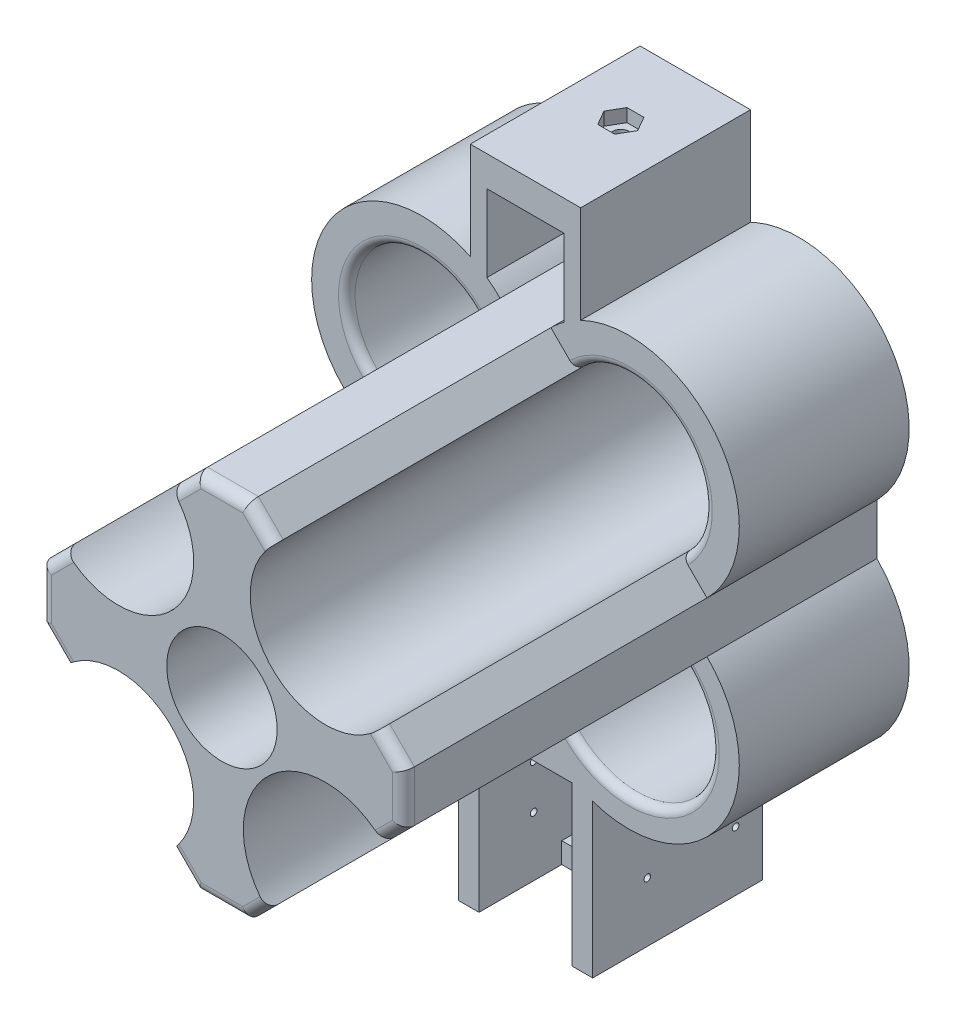
from build123d import *
from build123d.topology import SkipClean

# Parameters (mm, degrees)
SKETCH_1_R           = 27
SKETCH_1_R_2         = 29.5
EXTRUDE_1_DEPTH      = 50
EXTRUDE_START        = 110
EXTRUDE_2_DEPTH      = 110
SKETCH_3_R           = 20
CUT_EXTRUDE_1_DEPTH  = 70
SKETCH_22_R          = 20
EXTRUDE_6_DEPTH      = 171.56
FILLET_1_R           = 4
EXTRUDE_START_2      = 50
EXTRUDE_8_DEPTH      = 50
SKETCH_28_R          = 27.25
SKETCH_28_R_2        = 29.75
CUT_EXTRUDE_8_DEPTH  = 160
EXTRUDE_15_DEPTH     = 61.56
SKETCH_37_R          = 2.95
CUT_EXTRUDE_9_DEPTH  = 15
CUT_EXTRUDE_10_DEPTH = 4.75
SKETCH_41_W          = 48.7
SKETCH_41_H          = 65
SKETCH_41_W_2        = 33.7
SKETCH_41_H_2        = 50
EXTRUDE_16_DEPTH     = 61.56
SKETCH_42_W          = 33.7
SKETCH_42_H          = 50
EXTRUDE_17_DEPTH     = 3
SKETCH_43_W          = 33.7
SKETCH_43_H          = 30
CUT_EXTRUDE_11_DEPTH = 7.5
SKETCH_44_R          = 1.2
CUT_EXTRUDE_12_DEPTH = 199.942072292
FILLET_2_R           = 3


with BuildPart() as part:
    # 스케치1 → 보스-돌출1 (new body)
    with BuildSketch(Plane.XY):
        with BuildLine():
            ThreePointArc((0, 51.419410907), (65.784271247, 65.784271247), (51.419410907, 0))
            ThreePointArc((51.419410907, 0), (65.784271247, -65.784271247), (0, -51.419410907))
            ThreePointArc((0, -51.419410907), (-65.784271247, -65.784271247), (-51.419410907, 0))
            ThreePointArc((-51.419410907, 0), (-65.784271247, 65.784271247), (0, 51.419410907))
        make_face()
        with Locations((-37.5, 37.5)):
            Circle(SKETCH_1_R, mode=Mode.SUBTRACT)
        with Locations((37.5, 37.5)):
            Circle(SKETCH_1_R, mode=Mode.SUBTRACT)
        with Locations((-37.5, -37.5)):
            Circle(SKETCH_1_R, mode=Mode.SUBTRACT)
        with Locations((37.5, -37.5)):
            Circle(SKETCH_1_R_2, mode=Mode.SUBTRACT)
    extrude(amount=-EXTRUDE_1_DEPTH)

    # 스케치2 → 보스-돌출2 (add)
    with BuildSketch(Plane.XY.offset(EXTRUDE_START)):
        with BuildLine():
            ThreePointArc((9.215728753, -65.784271247), (3.832806933, -59.099076623), (0, -51.419410907))
            ThreePointArc((0, -51.419410907), (-3.832806933, -59.099076623), (-9.215728753, -65.784271247))
            Line((-9.215728753, -65.784271247), (-18.408116908, -56.591883092))
            ThreePointArc((-18.408116908, -56.591883092), (-18.408116908, -18.408116908), (-56.591883092, -18.408116908))
            Line((-56.591883092, -18.408116908), (-65.784271247, -9.215728753))
            ThreePointArc((-65.784271247, -9.215728753), (-59.099076623, -3.832806933), (-51.419410907, 0))
            ThreePointArc((-51.419410907, 0), (-59.099076623, 3.832806933), (-65.784271247, 9.215728753))
            Line((-65.784271247, 9.215728753), (-56.591883092, 18.408116908))
            ThreePointArc((-56.591883092, 18.408116908), (-18.408116908, 18.408116908), (-18.408116908, 56.591883092))
            Line((-18.408116908, 56.591883092), (-9.215728753, 65.784271247))
            ThreePointArc((-9.215728753, 65.784271247), (-3.832806933, 59.099076623), (0, 51.419410907))
            ThreePointArc((0, 51.419410907), (3.832806933, 59.099076623), (9.215728753, 65.784271247))
            Line((9.215728753, 65.784271247), (18.408116908, 56.591883092))
            ThreePointArc((18.408116908, 56.591883092), (18.408116908, 18.408116908), (56.591883092, 18.408116908))
            Line((56.591883092, 18.408116908), (65.784271247, 9.215728753))
            ThreePointArc((65.784271247, 9.215728753), (59.099076623, 3.832806933), (51.419410907, 0))
            ThreePointArc((51.419410907, 0), (59.099076623, -3.832806933), (65.784271247, -9.215728753))
            Line((65.784271247, -9.215728753), (58.359650045, -16.640349955))
            ThreePointArc((58.359650045, -16.640349955), (16.640349955, -16.640349955), (16.640349955, -58.359650045))
            Line((16.640349955, -58.359650045), (9.215728753, -65.784271247))
        make_face()
    extrude(amount=-EXTRUDE_2_DEPTH)

    # 스케치3 → 컷-돌출1 (cut)
    with BuildSketch(Plane.XY.offset(110)):
        Circle(SKETCH_3_R)
    extrude(amount=-CUT_EXTRUDE_1_DEPTH, mode=Mode.SUBTRACT)

    # 스케치4 → 회전1 (revolve)
    with BuildSketch(Plane(origin=(0, 37.5, 0), x_dir=(1, 0, 0), z_dir=(0, 1, 0)), mode=Mode.PRIVATE) as revolve_1_sk:
        Polygon((-57, 61.564692494), (-77.5, 61.564692494), (-77.5, 50), (-64.5, 50), (-44, 61.564692494), align=None)
    revolve(revolve_1_sk.sketch.rotate(Axis((-37.5, 37.5, -65.231546212), (0, 0, -1)), 180), axis=Axis((-37.5, 37.5, -65.231546212), (0, 0, -1)))

    # 스케치5 → 회전2 (revolve)
    with SkipClean():  # the faces are left unmerged after this step: merging them gives an invalid solid
        with BuildSketch(Plane(origin=(0, 37.5, 0), x_dir=(1, 0, 0), z_dir=(0, 1, 0))):
            Polygon((44, 61.564692494), (57, 61.564692494), (77.5, 61.564692494), (77.5, 50), (64.5, 50), align=None)
        revolve(axis=Axis((37.5, 37.5, -50), (0, 0, 1)))

    # 스케치6 → 회전3 (revolve)
    with SkipClean():  # the faces are left unmerged after this step: merging them gives an invalid solid
        with BuildSketch(Plane(origin=(0, -37.5, 0), x_dir=(1, 0, 0), z_dir=(0, 1, 0)), mode=Mode.PRIVATE) as revolve_3_sk:
            Polygon((-57, 61.564692494), (-77.5, 61.564692494), (-77.5, 50), (-64.5, 50), (-44, 61.564692494), align=None)
        revolve(revolve_3_sk.sketch.rotate(Axis((-37.5, -37.5, -65.231546212), (0, 0, -1)), 180), axis=Axis((-37.5, -37.5, -65.231546212), (0, 0, -1)))

    # 스케치7 → 회전4 (revolve)
    with SkipClean():  # the faces are left unmerged after this step: merging them gives an invalid solid
        with BuildSketch(Plane(origin=(0, -37.5, 0), x_dir=(1, 0, 0), z_dir=(0, 1, 0))):
            Polygon((46.75, 60.152594543), (46.75, 61.564692494), (77.5, 61.564692494), (77.5, 50), (67, 50), align=None)
        revolve(axis=Axis((37.5, -37.5, -64.790199458), (0, 0, -1)))

    # 스케치22 → 보스-돌출6 (add)
    with BuildSketch(Plane.XY.offset(110)):
        with BuildLine():
            ThreePointArc((58.889980131, -16.110019869), (16.110019869, -16.110019869), (16.110019869, -58.889980131))
            Line((16.110019869, -58.889980131), (9.215728753, -65.784271247))
            Line((9.215728753, -65.784271247), (-9.215728753, -65.784271247))
            Line((-9.215728753, -65.784271247), (-18.054563517, -56.945436483))
            ThreePointArc((-18.054563517, -56.945436483), (-18.054563517, -18.054563517), (-56.945436483, -18.054563517))
            Line((-56.945436483, -18.054563517), (-65.784271247, -9.215728753))
            Line((-65.784271247, -9.215728753), (-65.784271247, 9.215728753))
            Line((-65.784271247, 9.215728753), (-56.945436483, 18.054563517))
            ThreePointArc((-56.945436483, 18.054563517), (-18.054563517, 18.054563517), (-18.054563517, 56.945436483))
            Line((-18.054563517, 56.945436483), (-9.215728753, 65.784271247))
            Line((-9.215728753, 65.784271247), (9.215728753, 65.784271247))
            Line((9.215728753, 65.784271247), (18.054563517, 56.945436483))
            ThreePointArc((18.054563517, 56.945436483), (18.054563517, 18.054563517), (56.945436483, 18.054563517))
            Line((56.945436483, 18.054563517), (65.784271247, 9.215728753))
            Line((65.784271247, 9.215728753), (65.784271247, -9.215728753))
            Line((65.784271247, -9.215728753), (58.889980131, -16.110019869))
        make_face()
        Circle(SKETCH_22_R, mode=Mode.SUBTRACT)
    extrude(amount=-EXTRUDE_6_DEPTH)

    # 필렛1
    fillet_1_edges = [part.edges().sort_by_distance(p)[0] for p in [
        (0, -65.784271247, 110),
        (0, 65.784271247, 110),
        (65.784271247, 0, 110),
        (-65.784271247, 0, 110),
        (12.928039354, -62.071960646, 110),
        (61.18807717, 13.81192283, 110),
        (-13.81192283, 61.18807717, 110),
        (-61.18807717, -13.81192283, 110),
        (62.071960646, -12.928039354, 110),
        (13.81192283, 61.18807717, 110),
        (-61.18807717, 13.81192283, 110),
        (-13.81192283, -61.18807717, 110),
    ]]
    fillet(fillet_1_edges, radius=FILLET_1_R)

    # 스케치26 → 보스-돌출8 (add)
    with BuildSketch(Plane.XY.offset(-61.56).offset(EXTRUDE_START_2)):
        with BuildLine():
            ThreePointArc((9.215728753, -65.784271247), (3.832806933, -59.099076623), (0, -51.419410907))
            ThreePointArc((0, -51.419410907), (-3.832806933, -59.099076623), (-9.215728753, -65.784271247))
            Line((-9.215728753, -65.784271247), (-18.408116908, -56.591883092))
            ThreePointArc((-18.408116908, -56.591883092), (-18.408116908, -18.408116908), (-56.591883092, -18.408116908))
            Line((-56.591883092, -18.408116908), (-65.784271247, -9.215728753))
            ThreePointArc((-65.784271247, -9.215728753), (-59.099076623, -3.832806933), (-51.419410907, 0))
            ThreePointArc((-51.419410907, 0), (-59.099076623, 3.832806933), (-65.784271247, 9.215728753))
            Line((-65.784271247, 9.215728753), (-56.591883092, 18.408116908))
            ThreePointArc((-56.591883092, 18.408116908), (-18.408116908, 18.408116908), (-18.408116908, 56.591883092))
            Line((-18.408116908, 56.591883092), (-9.215728753, 65.784271247))
            ThreePointArc((-9.215728753, 65.784271247), (-3.832806933, 59.099076623), (0, 51.419410907))
            ThreePointArc((0, 51.419410907), (3.832806933, 59.099076623), (9.215728753, 65.784271247))
            Line((9.215728753, 65.784271247), (18.408116908, 56.591883092))
            ThreePointArc((18.408116908, 56.591883092), (18.408116908, 18.408116908), (56.591883092, 18.408116908))
            Line((56.591883092, 18.408116908), (65.784271247, 9.215728753))
            ThreePointArc((65.784271247, 9.215728753), (59.099076623, 3.832806933), (51.419410907, 0))
            ThreePointArc((51.419410907, 0), (59.099076623, -3.832806933), (65.784271247, -9.215728753))
            Line((65.784271247, -9.215728753), (58.359650045, -16.640349955))
            ThreePointArc((58.359650045, -16.640349955), (16.640349955, -16.640349955), (16.640349955, -58.359650045))
            Line((16.640349955, -58.359650045), (9.215728753, -65.784271247))
        make_face()
    extrude(amount=-EXTRUDE_8_DEPTH)

    # 스케치28 → 컷-돌출8 (cut)
    with BuildSketch(Plane.XY.offset(110)):
        with Locations((-37.5, 37.5)):
            Circle(SKETCH_28_R)
        with Locations(Location((37.5, 37.5, 0), (0, 0, 315))):
            Circle(SKETCH_28_R)
        with Locations(Location((-37.5, -37.5, 0), (0, 0, 323.440889441))):
            Circle(SKETCH_28_R)
        with Locations((37.5, -37.5)):
            Circle(SKETCH_28_R_2)
    extrude(amount=-CUT_EXTRUDE_8_DEPTH, mode=Mode.SUBTRACT)

    # 스케치36 → 보스-돌출15 (add)
    with BuildSketch(Plane.XY.offset(-61.56)):
        Polygon((20, 108.784271247), (20, 65.784271247), (14, 65.784271247), (14, 97.784271247), (-14, 97.784271247), (-14, 65.784271247), (-20, 65.784271247), (-20, 108.784271247), align=None)
    extrude(amount=EXTRUDE_15_DEPTH)

    # 스케치37 → 컷-돌출9 (cut)
    with BuildSketch(Plane(origin=(0, 108.784271247, 0), x_dir=(1, 0, 0), z_dir=(0, 1, 0))):
        with Locations(Location((0, 34.56, 0), (0, 0, 270))):
            Circle(SKETCH_37_R)
    extrude(amount=-CUT_EXTRUDE_9_DEPTH, mode=Mode.SUBTRACT)

    # 스케치39 → 컷-돌출10 (cut)
    with BuildSketch(Plane(origin=(0, 108.784271247, 0), x_dir=(1, 0, 0), z_dir=(0, 1, 0))):
        Polygon((3.059956427, 39.86), (-3.059956427, 39.86), (-6.119912853, 34.56), (-3.059956427, 29.26), (3.059956427, 29.26), (6.119912853, 34.56), align=None)
    extrude(amount=-CUT_EXTRUDE_10_DEPTH, mode=Mode.SUBTRACT)

    # 스케치41 → 보스-돌출16 (add)
    with BuildSketch(Plane.XY.offset(-61.56)):
        with Locations((0, -98.284271247)):
            Rectangle(SKETCH_41_W, SKETCH_41_H)
        with Locations((0, -98.284271247)):
            Rectangle(SKETCH_41_W_2, SKETCH_41_H_2, mode=Mode.SUBTRACT)
    extrude(amount=EXTRUDE_16_DEPTH)

    # 스케치42 → 보스-돌출17 (add)
    with BuildSketch(Plane(origin=(0, 0, -61.564692494), x_dir=(-1, 0, 0), z_dir=(0, 0, -1))):
        with Locations((0, -98.284271247)):
            Rectangle(SKETCH_42_W, SKETCH_42_H)
    extrude(amount=-EXTRUDE_17_DEPTH)

    # 스케치43 → 컷-돌출11 (cut)
    with BuildSketch(Plane.XZ.offset(130.784271247)):
        with Locations((0, -15)):
            Rectangle(SKETCH_43_W, SKETCH_43_H)
    extrude(amount=-CUT_EXTRUDE_11_DEPTH, mode=Mode.SUBTRACT)

    # 스케치44 → 컷-돌출12 (cut, through all)
    with BuildSketch(Plane(origin=(24.35, 0, 0), x_dir=(0, 0, -1), z_dir=(1, 0, 0))):
        with Locations(Location((51.81, -109.284271247, 0), (0, 0, 90))):
            Circle(SKETCH_44_R)
        with Locations(Location((51.81, -93.284271247, 0), (0, 0, 90))):
            Circle(SKETCH_44_R)
        with Locations(Location((19.81, -109.284271247, 0), (0, 0, 90))):
            Circle(SKETCH_44_R)
        with Locations(Location((19.81, -93.284271247, 0), (0, 0, 90))):
            Circle(SKETCH_44_R)
    extrude(amount=-CUT_EXTRUDE_12_DEPTH, mode=Mode.SUBTRACT)

    # 필렛2
    # the kernel refuses this fillet: 3 mm, written as the material it takes off along each edge
    with BuildSketch(Plane(origin=(37.5, 37.5, 0), x_dir=(0.7071067811865474, -0.7071067811865477, 0), z_dir=(-0.7071067811865477, -0.7071067811865474, 0))) as fillet_2_piece_1:
        with BuildLine():
            CenterArc((27.25 + FILLET_2_R, -FILLET_2_R), FILLET_2_R, 90, 90)
            Line((27.25 + FILLET_2_R, 0), (27.25, 0))
            Line((27.25, 0), (27.25, -FILLET_2_R))
        make_face()
    revolve(axis=Axis((37.5, 37.5, 0), (0, 0, 1)), revolution_arc=180, mode=Mode.SUBTRACT)
    with BuildSketch(Plane(origin=(-37.5, -37.5, 0), x_dir=(-0.7071067811865508, 0.7071067811865442, 0), z_dir=(0.7071067811865442, 0.7071067811865508, 0))) as fillet_2_piece_2:
        with BuildLine():
            CenterArc((27.25 + FILLET_2_R, -FILLET_2_R), FILLET_2_R, 90, 90)
            Line((27.25 + FILLET_2_R, 0), (27.25, 0))
            Line((27.25, 0), (27.25, -FILLET_2_R))
        make_face()
    revolve(axis=Axis((-37.5, -37.5, 0), (0, 0, 1)), revolution_arc=180, mode=Mode.SUBTRACT)
    with BuildSketch(Plane(origin=(37.5, -37.5, 0), x_dir=(-0.707106781186547, -0.707106781186548, 0), z_dir=(-0.707106781186548, 0.707106781186547, 0))) as fillet_2_piece_3:
        with BuildLine():
            CenterArc((29.75 + FILLET_2_R, -FILLET_2_R), FILLET_2_R, 90, 90)
            Line((29.75 + FILLET_2_R, 0), (29.75, 0))
            Line((29.75, 0), (29.75, -FILLET_2_R))
        make_face()
    revolve(axis=Axis((37.5, -37.5, 0), (0, 0, 1)), revolution_arc=135, mode=Mode.SUBTRACT)
    with BuildSketch(Plane(origin=(-37.5, 37.5, 0), x_dir=(0.7071067811865468, 0.7071067811865483, 0), z_dir=(0.7071067811865483, -0.7071067811865468, 0))) as fillet_2_piece_4:
        with BuildLine():
            CenterArc((27.25 + FILLET_2_R, -FILLET_2_R), FILLET_2_R, 90, 90)
            Line((27.25 + FILLET_2_R, 0), (27.25, 0))
            Line((27.25, 0), (27.25, -FILLET_2_R))
        make_face()
    revolve(axis=Axis((-37.5, 37.5, 0), (0, 0, 1)), revolution_arc=180, mode=Mode.SUBTRACT)
    with BuildSketch(Plane(origin=(37.5, -37.5, 0), x_dir=(1, 0, 0), z_dir=(0, -1, 0))) as fillet_2_piece_5:
        with BuildLine():
            CenterArc((29.75 + FILLET_2_R, -FILLET_2_R), FILLET_2_R, 90, 90)
            Line((29.75 + FILLET_2_R, 0), (29.75, 0))
            Line((29.75, 0), (29.75, -FILLET_2_R))
        make_face()
    revolve(axis=Axis((37.5, -37.5, 0), (0, 0, 1)), revolution_arc=45, mode=Mode.SUBTRACT)


solid = part.part
